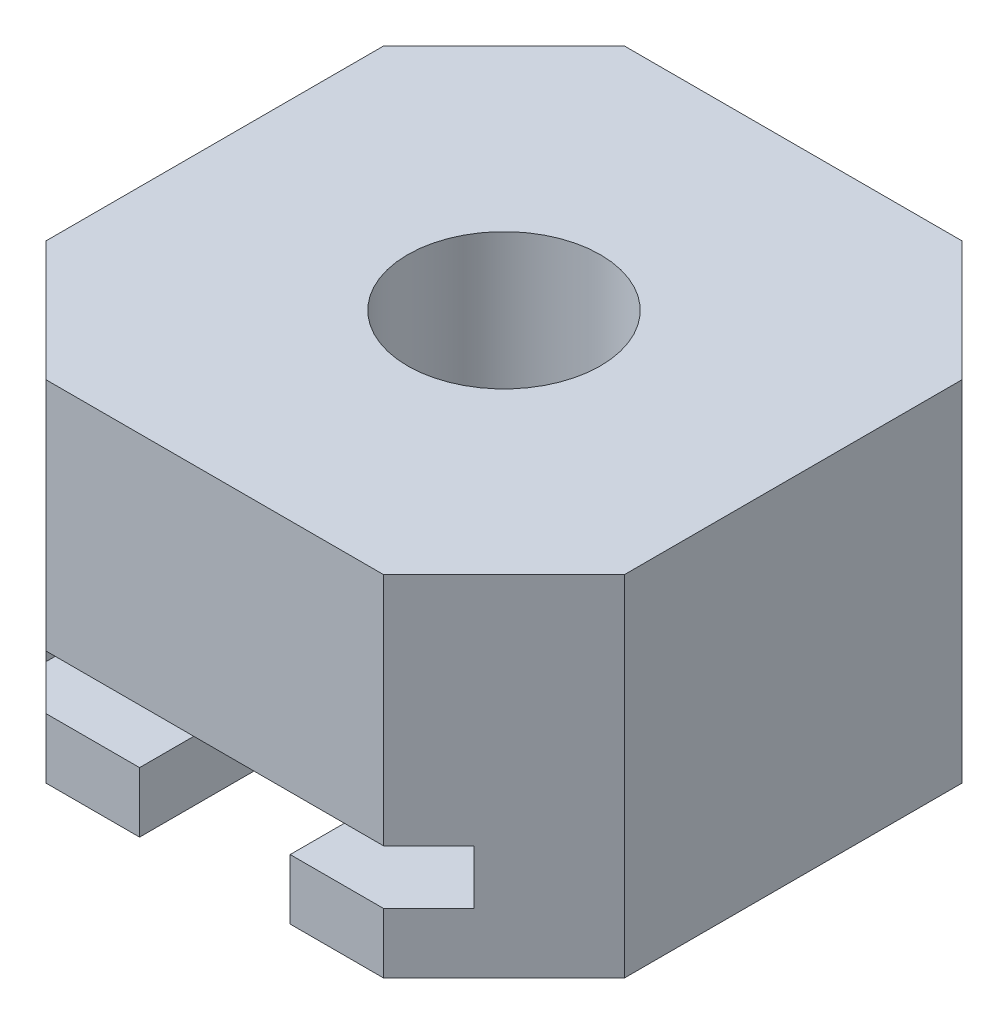
from build123d import *

# Parameters (mm, degrees)
SKETCH1_W           = 24.384
SKETCH1_H           = 24.384
BOSS_EXTRUDE1_DEPTH = 12.192
SKETCH2_W           = 24.384
SKETCH2_H           = 24.384
SKETCH2_R           = 3.175
BOSS_EXTRUDE2_DEPTH = 2.54
SKETCH3_W           = 6.35
SKETCH3_H           = 12.192
CUT_EXTRUDE1_DEPTH  = 2.54
CUT_EXTRUDE2_DEPTH  = 2.286
SKETCH5_W           = 24.384
SKETCH5_H           = 24.384
SKETCH5_R           = 4.064
BOSS_EXTRUDE3_DEPTH = 9.906
CHAMFER1_SIZE       = 5.08


with BuildPart() as part:
    # Sketch1 → Boss-Extrude1 (new body)
    with BuildSketch(Plane(origin=(0, 0, 0), x_dir=(1, 0, 0), z_dir=(0, 1, 0))):
        Rectangle(SKETCH1_W, SKETCH1_H)
        Polygon((-6.096, 9.017), (6.096, 9.017), (9.017, 6.096), (9.017, -6.096), (6.096, -9.017), (-6.096, -9.017), (-9.017, -6.096), (-9.017, 6.096), align=None, mode=Mode.SUBTRACT)
    extrude(amount=BOSS_EXTRUDE1_DEPTH)

    # Sketch2 → Boss-Extrude2 (add)
    with BuildSketch(Plane.XZ):
        Rectangle(SKETCH2_W, SKETCH2_H)
        with Locations(Location((0, 0, 0), (0, 0, 270))):
            Circle(SKETCH2_R, mode=Mode.SUBTRACT)
    extrude(amount=BOSS_EXTRUDE2_DEPTH)

    # Sketch3 → Cut-Extrude1 (cut)
    with BuildSketch(Plane.XZ.offset(2.54)):
        with Locations((0, 6.096)):
            Rectangle(SKETCH3_W, SKETCH3_H)
    extrude(amount=-CUT_EXTRUDE1_DEPTH, mode=Mode.SUBTRACT)

    # Sketch4 → Cut-Extrude2 (cut)
    with BuildSketch(Plane(origin=(0, 0, 0), x_dir=(1, 0, 0), z_dir=(0, 1, 0))):
        Polygon((-3.175, -6.096), (-9.017, -6.096), (-6.096, -9.017), (-3.175, -9.017), align=None)
        Polygon((-6.096, -9.017), (-9.017, -6.096), (-9.017, -12.192), (9.017, -12.192), (9.017, -6.096), (6.096, -9.017), (3.175, -9.017), (3.175, -6.096), (-3.175, -6.096), (-3.175, -9.017), align=None)
        Polygon((9.017, -6.096), (3.175, -6.096), (3.175, -9.017), (6.096, -9.017), align=None)
    extrude(amount=CUT_EXTRUDE2_DEPTH, mode=Mode.SUBTRACT)

    # Sketch5 → Boss-Extrude3 (add)
    with BuildSketch(Plane(origin=(0, 12.192, 0), x_dir=(1, 0, 0), z_dir=(0, 1, 0))):
        Rectangle(SKETCH5_W, SKETCH5_H)
        with Locations(Location((0, 0, 0), (0, 0, 270))):
            Circle(SKETCH5_R, mode=Mode.SUBTRACT)
    extrude(amount=-BOSS_EXTRUDE3_DEPTH)

    # Chamfer1
    # the kernel refuses this chamfer: 5.08 mm, written as the material it takes off along each edge
    with BuildSketch(Plane(origin=(12.192, 25.256149579, -12.192), x_dir=(0.027495876610586254, -5.537865568379339e-15, 0.9996219169112968), z_dir=(0, -1, 0)), Plane(origin=(12.192, -15.604149579, 12.192), x_dir=(0.027495876610586268, 0, -0.9996219169112968), z_dir=(0, 1, 0))) as chamfer1_piece_1:
        Polygon((CHAMFER1_SIZE * 0.999621916911, CHAMFER1_SIZE * 0.0274958766106), (-CHAMFER1_SIZE * 0.0274958766106, CHAMFER1_SIZE * 0.999621916911), (0, 0), align=None)
    extrude(amount=40.860299158, mode=Mode.SUBTRACT)
    with BuildSketch(Plane(origin=(-12.192, 25.256149579, -12.192), x_dir=(-0.027495876610586265, -3.4921279629514554e-15, 0.9996219169112968), z_dir=(0, -1, 0)), Plane(origin=(-12.192, -15.604149579, 12.192), x_dir=(-0.027495876610586275, 0, -0.9996219169112968), z_dir=(0, 1, 0))) as chamfer1_piece_2:
        Polygon((CHAMFER1_SIZE * 0.999621916911, -CHAMFER1_SIZE * 0.0274958766106), (-CHAMFER1_SIZE * 0.0274958766106, -CHAMFER1_SIZE * 0.999621916911), (0, 0), align=None)
    extrude(amount=40.860299158, mode=Mode.SUBTRACT)


solid = part.part
